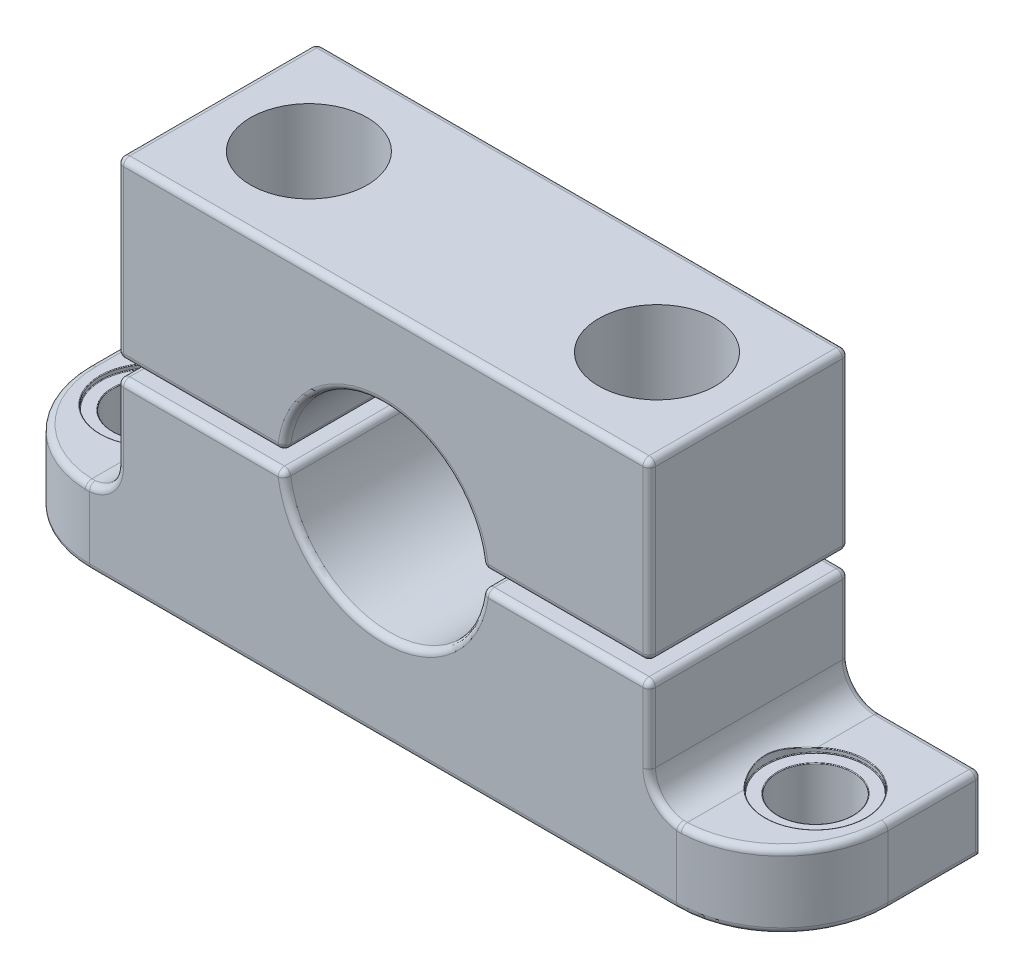
from build123d import *

# Parameters (mm, degrees)
BOSS_EXTRUDE1_DEPTH   = 12
BOSS_EXTRUDE1_2_DEPTH = 12
SKETCH4_R             = 2.25
CUT_EXTRUDE1_DEPTH    = 35.992164837
SKETCH8_R             = 3.012
CUT_EXTRUDE3_DEPTH    = 6.714
SKETCH10_R            = 2.254
CUT_EXTRUDE4_DEPTH    = 35.992164872
SKETCH12_R            = 3.5125
CUT_EXTRUDE5_DEPTH    = 7.015
FILLET1_R             = 0.381
FILLET4_R             = 6.35
FILLET2_R             = 0.381
FILLET3_R             = 0.0381


with BuildPart() as part:
    # Sketch3 → Boss-Extrude1 (new body)
    with BuildSketch(Plane.XY):
        with BuildLine():
            Line((-16, 22.46), (16, 22.46))
            Line((16, 22.46), (16, 11.968))
            Line((16, 11.968), (5.978455988, 11.968))
            ThreePointArc((5.978455988, 11.968), (0, 17.46), (-5.978455988, 11.968))
            Line((-5.978455988, 11.968), (-16, 11.968))
            Line((-16, 11.968), (-16, 22.46))
        make_face()
    extrude(amount=-BOSS_EXTRUDE1_DEPTH)


with BuildPart() as body_2:
    # Sketch3 → Boss-Extrude1 2 (new body)
    with BuildSketch(Plane.XY):
        with BuildLine():
            Line((-16, 10.952), (-16, 6.397))
            ThreePointArc((-16, 6.397), (-16.557961582, 5.049961582), (-17.905, 4.492))
            Line((-17.905, 4.492), (-24, 4.492))
            Line((-24, 4.492), (-24, 0))
            Line((-24, 0), (24, 0))
            Line((24, 0), (24, 4.492))
            Line((24, 4.492), (17.905, 4.492))
            ThreePointArc((17.905, 4.492), (16.557961582, 5.049961582), (16, 6.397))
            Line((16, 6.397), (16, 10.952))
            Line((16, 10.952), (5.978455988, 10.952))
            ThreePointArc((5.978455988, 10.952), (0, 5.46), (-5.978455988, 10.952))
            Line((-5.978455988, 10.952), (-16, 10.952))
        make_face()
    extrude(amount=-BOSS_EXTRUDE1_2_DEPTH)

    # Sketch4 → Cut-Extrude1 (cut, through all)
    with BuildSketch(Plane.XZ):
        with Locations((-20, -6)):
            Circle(SKETCH4_R)
        with Locations(Location((20, -6, 0), (0, 0, 158.608684568))):
            Circle(SKETCH4_R)
    extrude(amount=-CUT_EXTRUDE1_DEPTH, mode=Mode.SUBTRACT)

    # Sketch8 → Cut-Extrude3 (cut)
    with BuildSketch(Plane(origin=(0, 10.952, 0), x_dir=(1, 0, 0), z_dir=(0, 1, 0))):
        with Locations(Location((-20, 6, 0), (0, 0, 180))):
            Circle(SKETCH8_R)
        with Locations(Location((20, 6, 0), (0, 0, 225.928848663))):
            Circle(SKETCH8_R)
    extrude(amount=-CUT_EXTRUDE3_DEPTH, mode=Mode.SUBTRACT)


with BuildPart() as cut_extrude4_tool:
    # Sketch10 → Cut-Extrude4 (new, through all)
    with BuildSketch(Plane(origin=(0, 22.46, 0), x_dir=(1, 0, 0), z_dir=(0, 1, 0))):
        with Locations((10.468, 6)):
            Circle(SKETCH10_R)
        with Locations(Location((-10.468, 6, 0), (0, 0, 180))):
            Circle(SKETCH10_R)
    extrude(amount=-CUT_EXTRUDE4_DEPTH)


with BuildPart() as part_1:
    add(part.part)

    # Cut-Extrude4: cut by cut_extrude4_tool
    add(cut_extrude4_tool.part, mode=Mode.SUBTRACT)

    # Sketch12 → Cut-Extrude5 (cut)
    with BuildSketch(Plane(origin=(0, 22.46, 0), x_dir=(1, 0, 0), z_dir=(0, 1, 0))):
        with Locations((10.468, 6)):
            Circle(SKETCH12_R)
        with Locations(Location((-10.468, 6, 0), (0, 0, 180))):
            Circle(SKETCH12_R)
    extrude(amount=-CUT_EXTRUDE5_DEPTH, mode=Mode.SUBTRACT)

    # Fillet1
    fillet1_edges = [part_1.edges().sort_by_distance(p)[0] for p in [
        (0, 17.46, -12),
        (-16, 22.46, -6),
        (16, 22.46, -6),
        (16, 11.968, -6),
        (5.978455988, 11.968, -6),
        (-5.978455988, 11.968, -6),
        (-16, 11.968, -6),
        (10.989227994, 11.968, -12),
        (16, 17.214, -12),
        (0, 22.46, -12),
        (-16, 17.214, -12),
        (0, 22.46, 0),
        (16, 17.214, 0),
        (10.989227994, 11.968, 0),
        (-10.989227994, 11.968, -12),
        (0, 17.46, 0),
        (-10.989227994, 11.968, 0),
        (-16, 17.214, 0),
    ]]
    fillet(fillet1_edges, radius=FILLET1_R)


with BuildPart() as body_2_1:
    add(body_2.part)

    # Cut-Extrude4: cut by cut_extrude4_tool
    add(cut_extrude4_tool.part, mode=Mode.SUBTRACT)

    # Fillet4
    # the kernel refuses this fillet: 6.35 mm, written as the material it takes off along each edge
    with BuildSketch(Plane(origin=(24, -15.875, 0), x_dir=(-1, 0, 0), z_dir=(0, 1, 0)), Plane(origin=(-24, 20.367, 0), x_dir=(1, 0, 0), z_dir=(0, -1, 0))) as fillet4_piece_1:
        with BuildLine():
            CenterArc((FILLET4_R, -FILLET4_R), FILLET4_R, 90, 90)
            Line((0, -FILLET4_R), (0, 0))
            Line((0, 0), (FILLET4_R, 0))
        make_face()
    extrude(amount=36.242, mode=Mode.SUBTRACT)

    # Fillet2
    fillet2_edges = [body_2_1.edges().sort_by_distance(p)[0] for p in [
        (-16.557961582, 5.049961582, -12),
        (0, 5.46, 0),
        (10.989227994, 10.952, 0),
        (16, 8.6745, 0),
        (-20.9525, 4.492, -12),
        (-16.470636029, 5.143355313, 0),
        (-16, 8.6745, 0),
        (-10.989227994, 10.952, 0),
        (-24, 2.246, -12),
        (-5.978455988, 10.952, -6),
        (5.978455988, 10.952, -6),
        (16, 10.952, -6),
        (24, 4.492, -9.175),
        (24, 0, -9.175),
        (-24, 0, -9.175),
        (-24, 4.492, -9.175),
        (-16, 10.952, -6),
        (24, 2.246, -12),
        (20.9525, 4.492, -12),
        (16.557961582, 5.049961582, -12),
        (16, 8.6745, -12),
        (10.989227994, 10.952, -12),
        (0, 5.46, -12),
        (-10.989227994, 10.952, -12),
        (-16, 8.6745, -12),
        (0, 0, 0),
        (16.470636029, 5.143355313, 0),
        (17.777237887, 4.496289121, -0.00127489),
        (22.229396794, 4.492, -1.950951807),
        (-22.140128061, 0, -1.859871939),
        (22.140128061, 0, -1.859871939),
        (-22.229396794, 4.492, -1.950951807),
        (-17.777237887, 4.496289121, -0.00127489),
    ]]
    fillet(fillet2_edges, radius=FILLET2_R)

    # Fillet3
    fillet3_edges = [body_2_1.edges().sort_by_distance(p)[0] for p in [
        (-16.988, 4.727228758, -6),
        (-21.175160415, 4.492, -3.226709175),
        (-16.988, 4.238, -6),
        (-22.25, 4.238, -6),
        (23.012, 4.492, -6),
        (16.988, 4.727228758, -6),
        (22.095, 4.238, -6.820655226),
        (22.095, 4.238, -8.164051524),
    ]]
    fillet(fillet3_edges, radius=FILLET3_R)


solid = Compound([part_1.part, body_2_1.part])
